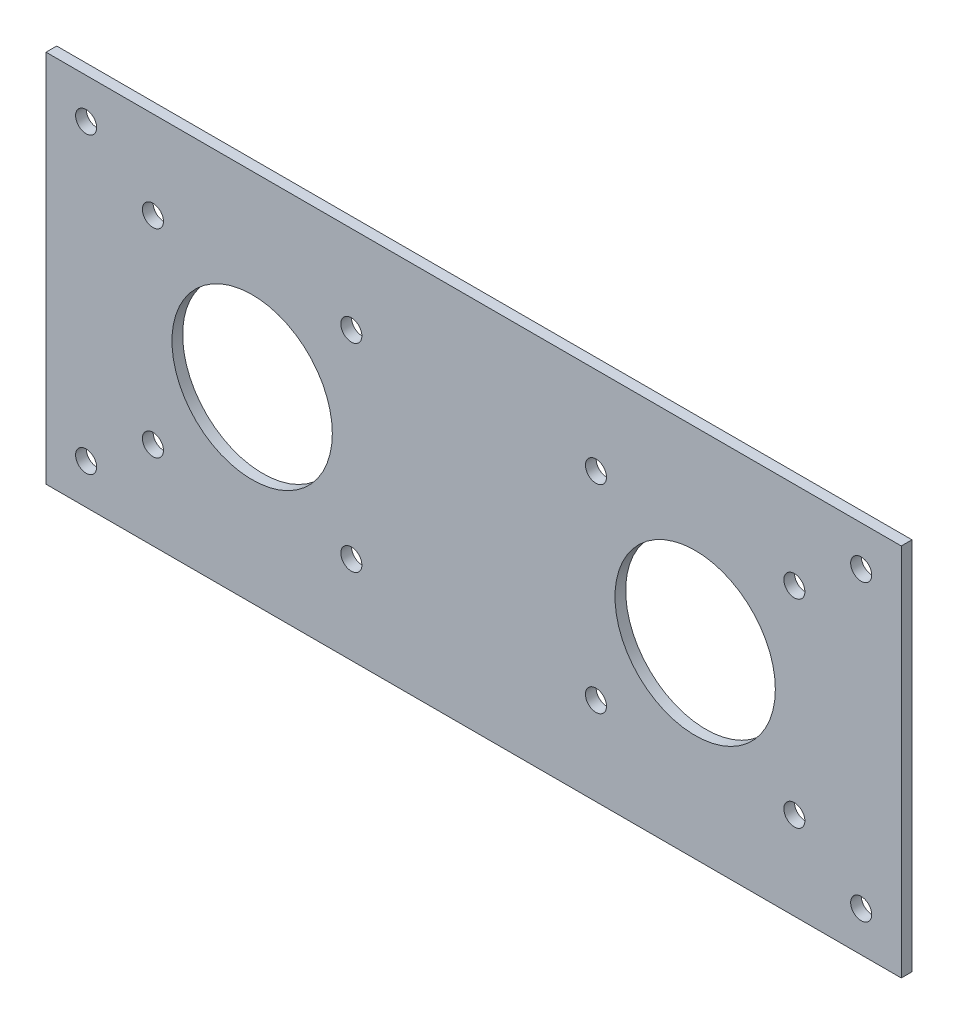
from build123d import *

# Parameters (mm, degrees)
SKETCH2_W           = 203.2
SKETCH2_H           = 88.9
SKETCH2_R           = 2.5
SKETCH2_R_2         = 19.05
BOSS_EXTRUDE1_DEPTH = 1.27
SKETCH3_R           = 2.5
CUT_EXTRUDE1_DEPTH  = 111.92706658


with BuildPart() as part:
    # Sketch2 → Boss-Extrude1 (new, symmetric)
    with BuildSketch(Plane.XY):
        Rectangle(SKETCH2_W, SKETCH2_H)
        with Locations((-76.2, -23.57)):
            Circle(SKETCH2_R, mode=Mode.SUBTRACT)
        with Locations((-29.06, -23.57)):
            Circle(SKETCH2_R, mode=Mode.SUBTRACT)
        with Locations((-29.06, 23.57)):
            Circle(SKETCH2_R, mode=Mode.SUBTRACT)
        with Locations((-76.2, 23.57)):
            Circle(SKETCH2_R, mode=Mode.SUBTRACT)
        with Locations((29.06, 23.57)):
            Circle(SKETCH2_R, mode=Mode.SUBTRACT)
        with Locations((76.2, 23.57)):
            Circle(SKETCH2_R, mode=Mode.SUBTRACT)
        with Locations((29.06, -23.57)):
            Circle(SKETCH2_R, mode=Mode.SUBTRACT)
        with Locations((76.2, -23.57)):
            Circle(SKETCH2_R, mode=Mode.SUBTRACT)
        with Locations((-52.63, 0)):
            Circle(SKETCH2_R_2, mode=Mode.SUBTRACT)
        with Locations((52.63, 0)):
            Circle(SKETCH2_R_2, mode=Mode.SUBTRACT)
    extrude(amount=BOSS_EXTRUDE1_DEPTH, both=True)

    # Sketch3 → Cut-Extrude1 (cut, through all)
    with BuildSketch(Plane.XY.offset(1.27)):
        with Locations((-92.075, 34.925)):
            Circle(SKETCH3_R)
        with Locations((-92.075, -34.925)):
            Circle(SKETCH3_R)
        with Locations((92.075, -34.925)):
            Circle(SKETCH3_R)
        with Locations((92.075, 34.925)):
            Circle(SKETCH3_R)
    extrude(amount=-CUT_EXTRUDE1_DEPTH, mode=Mode.SUBTRACT)


solid = part.part
